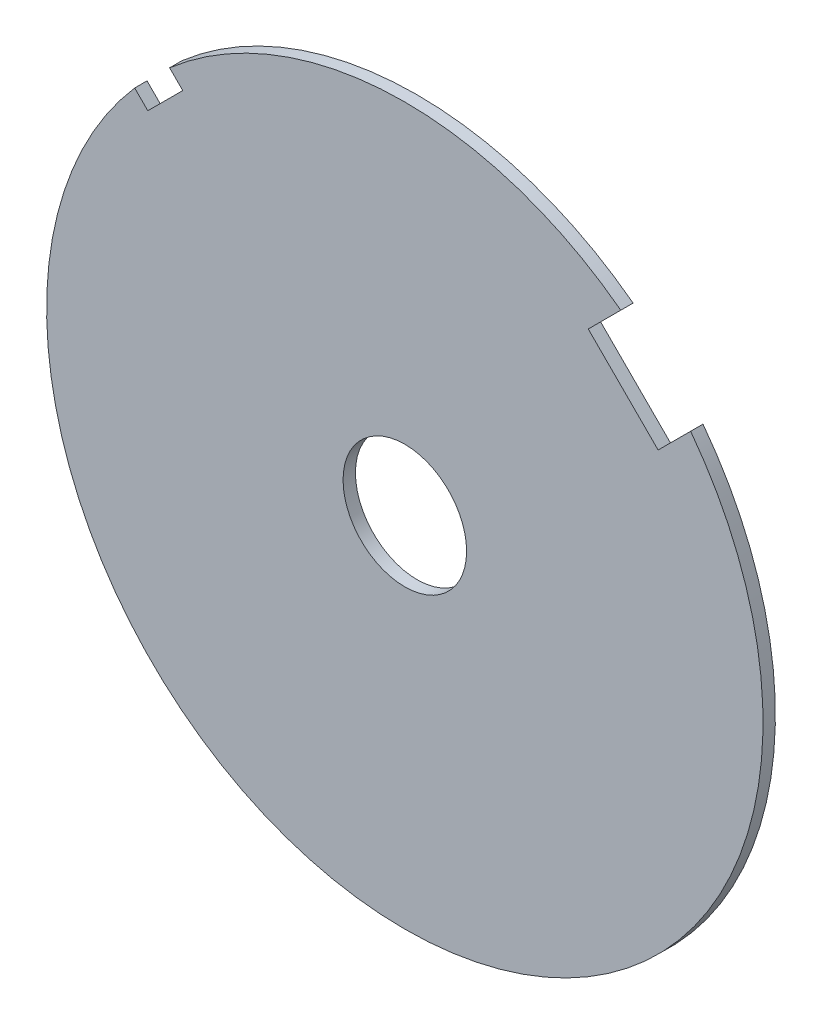
from build123d import *

# Parameters (mm, degrees)
CROQUIS1_R            = 7.25
BRIDA_BASE1_DEPTH     = 0.25
CROQUIS5_R            = 1.25
CORTAR_EXTRUIR1_DEPTH = 10
CORTAR_EXTRUIR2_DEPTH = 10


# Sheet-metal steps are written as plain solids
with BuildPart() as part:
    # Croquis1 → Brida base1 (new body)
    with BuildSketch(Plane.XY):
        Circle(CROQUIS1_R)
    extrude(amount=-BRIDA_BASE1_DEPTH)

    # Croquis5 → Cortar-Extruir1 (cut)
    with BuildSketch(Plane(origin=(0, 0, -0.25), x_dir=(-1, 0, 0), z_dir=(0, 0, -1))):
        Circle(CROQUIS5_R)
    extrude(amount=-CORTAR_EXTRUIR1_DEPTH, mode=Mode.SUBTRACT)

    # Croquis6 → Cortar-Extruir2 (cut)
    with BuildSketch(Plane.XY):
        Polygon((-5.480077554, 4.772970773), (-4.772970773, 5.480077554), (-4.494932198, 5.202038979), (-5.202038979, 4.494932198), align=None)
        Polygon((5.833630945, 4.419417382), (4.419417382, 5.833630945), (3.712310601, 5.126524164), (5.126524164, 3.712310601), align=None)
    extrude(amount=-CORTAR_EXTRUIR2_DEPTH, mode=Mode.SUBTRACT)


solid = part.part
